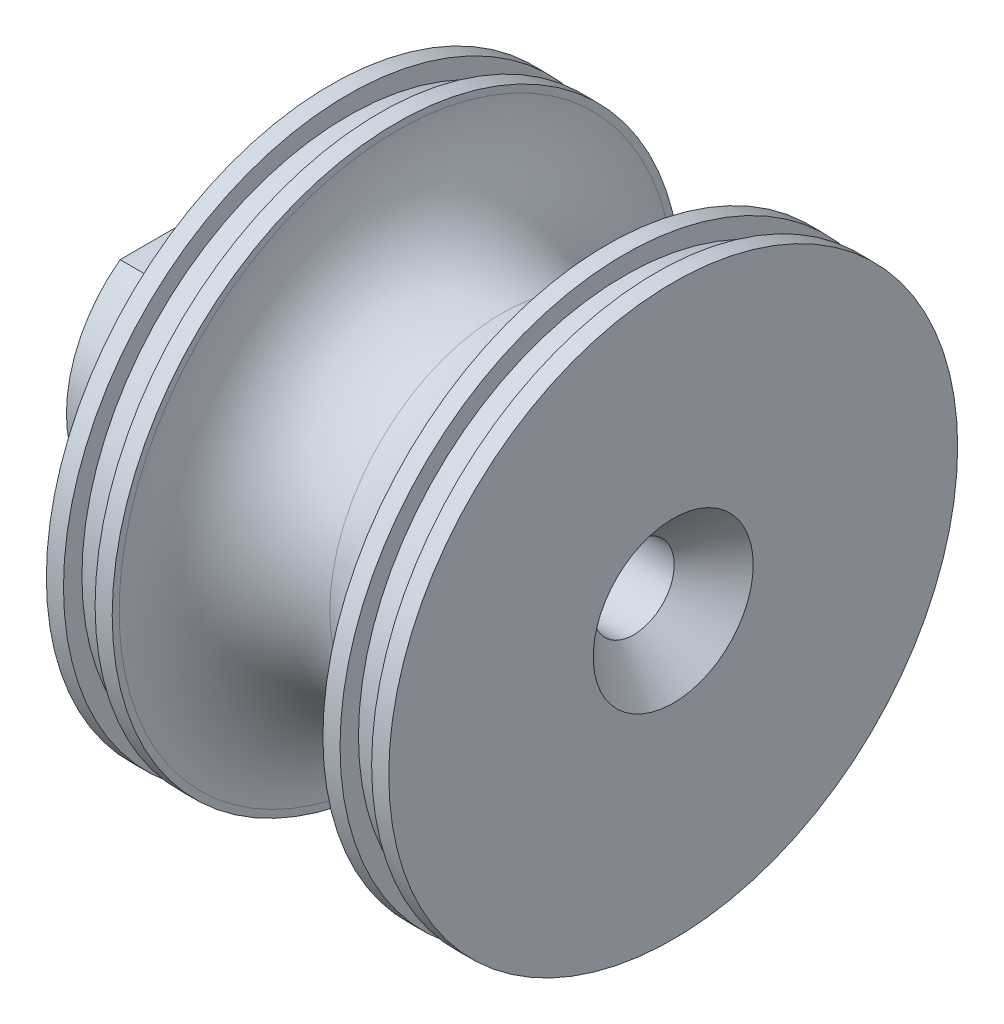
from build123d import *

# Parameters (mm, degrees)
FILLET3_R               = 8
FILLET4_R               = 8
SKETCH3_W               = 12
SKETCH3_H               = 3.642473792
CUT_EXTRUDE1_DEPTH      = 10
CUT_EXTRUDE2_REACH      = 46.992
CUT_EXTRUDE2_END_RADIUS = 3.075
SKETCH4_R               = 1.5
CHAMFER1_SIZE           = 3


with BuildPart() as part:
    # Sketch1 → Revolve1 (revolve)
    with BuildSketch(Plane.XY, mode=Mode.PRIVATE) as revolve1_sk:
        Polygon((0, 21.6), (1.3, 21.6), (1.3, 20.2), (3.7, 20.2), (3.7, 21.6), (5, 21.6), (5, 13.075), (21, 13.075), (21, 21.6), (22.3, 21.6), (22.3, 20.2), (24.7, 20.2), (24.7, 21.6), (26, 21.6), (26, 3.075), (-10, 3.075), (-10, 10.075), (0, 10.075), align=None)
    revolve(revolve1_sk.sketch.rotate(Axis((0, 0, 0), (1, 0, 0)), 90), axis=Axis((0, 0, 0), (1, 0, 0)))

    # Fillet3
    fillet3_edges = [part.edges().sort_by_distance(p)[0] for p in [
        (5, 0, -13.075),
    ]]
    fillet(fillet3_edges, radius=FILLET3_R)

    # Fillet4
    fillet4_edges = [part.edges().sort_by_distance(p)[0] for p in [
        (21, 0, -13.075),
    ]]
    fillet(fillet4_edges, radius=FILLET4_R - 0.0001)  # a hair under: the kernel refuses the full size

    # Sketch3 → Cut-Extrude1 (cut)
    with BuildSketch(Plane.ZY.offset(10)):
        with Locations((0, 9.91479143)):
            Rectangle(SKETCH3_W, SKETCH3_H)
    extrude(amount=-CUT_EXTRUDE1_DEPTH, mode=Mode.SUBTRACT)

    # Cut-Extrude2: up to this cylinder (the profile starts outside it)
    cut_extrude2_end = Plane(origin=(-5, 0, 0), z_dir=(-1, 0, 0)) * Cylinder(CUT_EXTRUDE2_END_RADIUS, 101.134, mode=Mode.PRIVATE)
    # Sketch4 → Cut-Extrude2 (cut, up to the surface)
    with BuildSketch(Plane(origin=(0, 8.093554534, 0), x_dir=(1, 0, 0), z_dir=(0, 1, 0)), mode=Mode.PRIVATE) as cut_extrude2_sk1:
        with Locations(Location((-5, 0, 0), (0, 0, 270))):
            Circle(SKETCH4_R)
    cut_extrude2_tool1 = extrude(cut_extrude2_sk1.sketch, amount=-CUT_EXTRUDE2_REACH, mode=Mode.PRIVATE) - cut_extrude2_end
    add(cut_extrude2_tool1.solids().sort_by_distance((-5, 8.093555, 0))[0], mode=Mode.SUBTRACT)

    # Chamfer1
    chamfer1_edges = [part.edges().sort_by_distance(p)[0] for p in [
        (26, 0, -3.075),
    ]]
    chamfer(chamfer1_edges, length=CHAMFER1_SIZE)


solid = part.part
